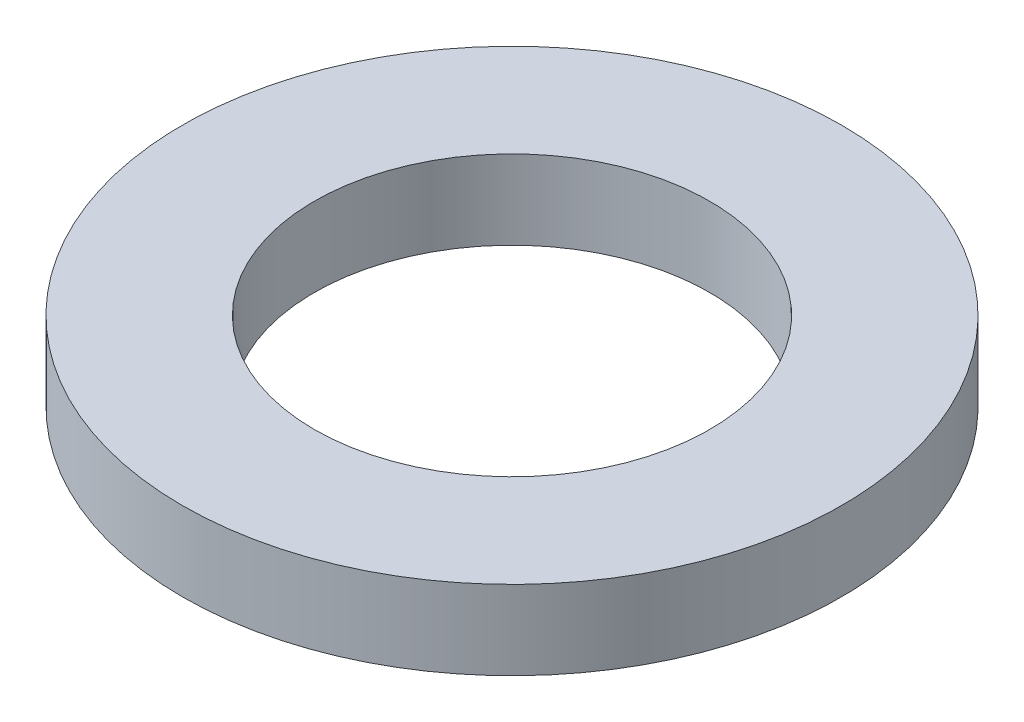
from build123d import *

# Parameters (mm, degrees)
SKETCH1_R           = 25
BOSS_EXTRUDE1_DEPTH = 6
SKETCH2_R           = 15
CUT_EXTRUDE1_DEPTH  = 36.860842154


with BuildPart() as part:
    # Sketch1 → Boss-Extrude1 (new body)
    with BuildSketch(Plane(origin=(0, 0, 0), x_dir=(1, 0, 0), z_dir=(0, 1, 0))):
        Circle(SKETCH1_R)
    extrude(amount=BOSS_EXTRUDE1_DEPTH)

    # Sketch2 → Cut-Extrude1 (cut, through all)
    with BuildSketch(Plane(origin=(0, 0, 0), x_dir=(1, 0, 0), z_dir=(0, 1, 0))):
        Circle(SKETCH2_R)
    extrude(amount=CUT_EXTRUDE1_DEPTH, mode=Mode.SUBTRACT)


solid = part.part
